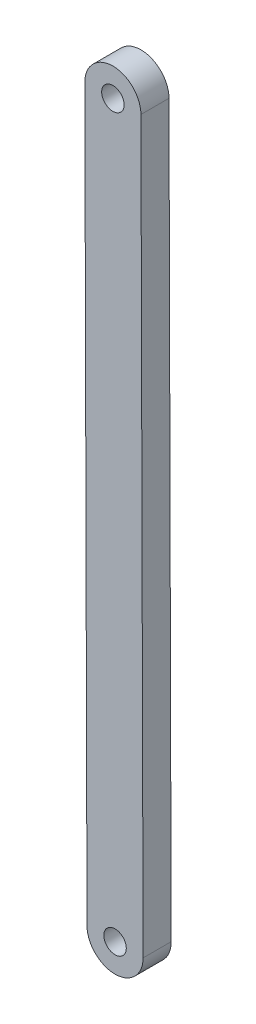
from build123d import *

# Parameters (mm, degrees)
BOSS_EXTRUDE1_START = 5
SKETCH1_R           = 2
BOSS_EXTRUDE1_DEPTH = 5


with BuildPart() as part:
    # Sketch1 → Boss-Extrude1 (new body)
    with BuildSketch(Plane.XY.offset(BOSS_EXTRUDE1_START)):
        with BuildLine():
            Line((-16.183517393, 155.953209612), (-15.795758727, 25.953787909))
            ThreePointArc((-15.795758727, 25.953787909), (-20.78082269, 20.938896356), (-25.795714242, 25.923960319))
            Line((-25.795714242, 25.923960319), (-26.183472909, 155.923382023))
            ThreePointArc((-26.183472909, 155.923382023), (-21.198408946, 160.938273575), (-16.183517393, 155.953209612))
        make_face()
        with Locations((-20.795736484, 25.938874114)):
            Circle(SKETCH1_R, mode=Mode.SUBTRACT)
        with Locations((-21.183495151, 155.938295817)):
            Circle(SKETCH1_R, mode=Mode.SUBTRACT)
    extrude(amount=BOSS_EXTRUDE1_DEPTH)


solid = part.part
